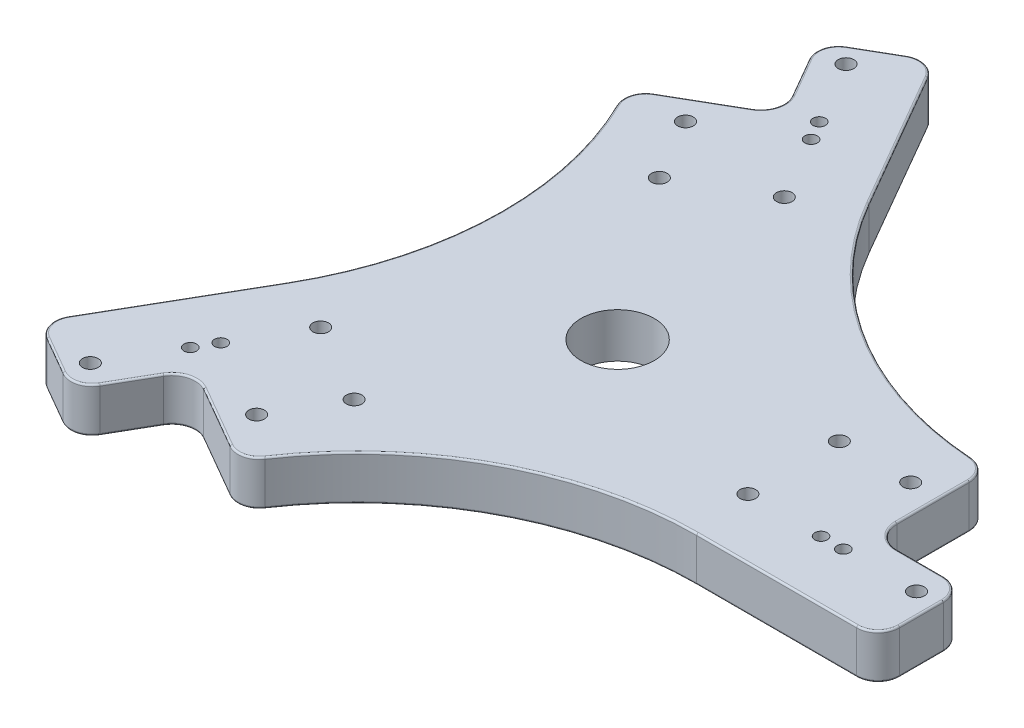
from build123d import *

# Parameters (mm, degrees)
SKETCH1_R                   = 41
BOSS_EXTRUDE1_DEPTH         = 50
FILLET2_R                   = 2
SKETCH3_R                   = 8.75
LOVIT_D17_5_THRU_DEPTH      = 623.015124039
SKETCH4_R                   = 12
LOBAC_D24X5_DEPTH           = 5
SKETCH5_R                   = 7
LOCHOT_D14_THRU_DEPTH       = 623.015124039
PATTERN_LOVIT_X3_COUNT      = 3
SKETCH6_R                   = 10
LOBAC_D20X5_DEPTH           = 5
PATTERN_LOBAC14_X3_COUNT    = 3
BOSS_EXTRUDE2_DEPTH         = 225
MATTREOVAU_D25_START        = -175
MATTREOVAU_D25_DEPTH        = 25
MATTREOVAU_GUSSET6_START    = -175
MATTREOVAU_GUSSET6_DEPTH    = 25
MATTREOVAU_GUSSET6_2_DEPTH  = 25
MATTREOVAU_GUSSET6_3_DEPTH  = 25
MATTREOVAU_GUSSET6_4_DEPTH  = 25
MATTREOVAU_GUSSET6_5_DEPTH  = 25
MATTREOTRON_X2_START        = -175
SKETCH10_R                  = 129.92
MATTREOTRON_X2_DEPTH        = 25
MATTREOTRON_X2_2_DEPTH      = 25
SK_TOOLCATKHUNG_W           = 940
SK_TOOLCATKHUNG_H           = 940
TOOL_CATCHANKHUNG_DEPTH     = 50
LOBAT_M16_X9_START          = -175
SK_LOVAU9_R                 = 7
LOBAT_M16_X9_DEPTH          = 25
LOGIUA_D150_START           = -175
SK_LOGIUA_R                 = 75
LOGIUA_D150_DEPTH           = 25
LOVIT_M20_X6_START          = -175
SKETCH12_R                  = 8.75
LOVIT_M20_X6_DEPTH          = 25
PADVIT_M12_X6_START         = -150
PADVIT_M12_X6_DEPTH         = 25
PADVIT_M12_X6_2_DEPTH       = 25
PADVIT_M12_X6_3_DEPTH       = 25
PADVIT_M12_X6_4_DEPTH       = 25
PADVIT_M12_X6_5_DEPTH       = 25
PADVIT_M12_X6_6_DEPTH       = 25
LOBU_M12_THRU_X6_START      = -175
SK_LOBU_M12_R               = 6.75
LOBU_M12_THRU_X6_DEPTH      = 25
LOBU_M12_CBORE_X6_START     = -187
SK_CBORE_M12_R              = 10
LOBU_M12_CBORE_X6_DEPTH     = 13
LOREN_M12_PAD_X6_START      = -175
SK_REN_M12_R                = 5.1
LOREN_M12_PAD_X6_DEPTH      = 20
BOSS_PADGOC_X3_START        = -175
SKETCH13_R                  = 32
BOSS_PADGOC_X3_DEPTH        = 25
BOSS_PADGOC_X3_2_DEPTH      = 25
BOSS_PADGOC_X3_3_DEPTH      = 25
LOBU_M12_THRU_GOC_X3_START  = -175
SKETCH14_R                  = 6.75
LOBU_M12_THRU_GOC_X3_DEPTH  = 12
LOBU_M12_CBORE_GOC_X3_START = -187
SKETCH15_R                  = 10
LOBU_M12_CBORE_GOC_X3_DEPTH = 13
LOREN_M12_GOC_X3_START      = -175
SKETCH16_R                  = 5.1
LOREN_M12_GOC_X3_DEPTH      = 20


with BuildPart() as part:
    # Sketch1 → Boss-Extrude1 (new body)
    with BuildSketch(Plane(origin=(0, 0, 0), x_dir=(1, 0, 0), z_dir=(0, 1, 0))):
        with BuildLine():
            Line((8.371578903, 273.5), (-81.292341855, 428.802466359))
            ThreePointArc((-81.292341855, 428.802466359), (-95.865294463, 439.98468619), (-114.076951546, 437.58707605))
            Line((-114.076951546, 437.58707605), (-156.512196331, 413.08707605))
            ThreePointArc((-156.512196331, 413.08707605), (-167.694416162, 398.514123442), (-165.296806022, 380.302466359))
            Line((-165.296806022, 380.302466359), (-139.296806022, 335.269145362))
            ThreePointArc((-139.296806022, 335.269145362), (-136.699395037, 315.53985019), (-148.813466521, 299.752484864))
            Line((-148.813466521, 299.752484864), (-218.954486267, 259.256548232))
            ThreePointArc((-218.954486267, 259.256548232), (-229.90514131, 245.491014911), (-228.527519154, 227.955082924))
            ThreePointArc((-228.527519154, 227.955082924), (-190.232761583, 47.667531746), (-241.043737387, -129.5))
            Line((-241.043737387, -129.5), (-330.707658145, -284.802466359))
            ThreePointArc((-330.707658145, -284.802466359), (-333.105268285, -303.014123442), (-321.923048454, -317.58707605))
            Line((-321.923048454, -317.58707605), (-279.487803669, -342.08707605))
            ThreePointArc((-279.487803669, -342.08707605), (-261.276146586, -344.48468619), (-246.703193978, -333.302466359))
            Line((-246.703193978, -333.302466359), (-220.703193978, -288.269145362))
            ThreePointArc((-220.703193978, -288.269145362), (-204.915828652, -276.155073879), (-185.186533479, -278.752484864))
            Line((-185.186533479, -278.752484864), (-115.045513733, -319.248421496))
            ThreePointArc((-115.045513733, -319.248421496), (-97.648884659, -321.849200291), (-83.151133157, -311.888178513))
            ThreePointArc((-83.151133157, -311.888178513), (53.835087364, -188.580170036), (232.672158483, -144))
            Line((232.672158483, -144), (412, -144))
            ThreePointArc((412, -144), (428.970562748, -136.970562748), (436, -120))
            Line((436, -120), (436, -71))
            ThreePointArc((436, -71), (428.970562748, -54.029437252), (412, -47))
            Line((412, -47), (360, -47))
            ThreePointArc((360, -47), (341.615223689, -39.384776311), (334, -21))
            Line((334, -21), (334, 59.991873264))
            ThreePointArc((334, 59.991873264), (327.554025969, 76.35818538), (311.678652311, 83.933095589))
            ThreePointArc((311.678652311, 83.933095589), (136.397674219, 140.91263829), (8.371578903, 273.5))
        make_face()
        with Locations(Location((0, 0, 0), (0, 0, 270))):
            Circle(SKETCH1_R, mode=Mode.SUBTRACT)
    extrude(amount=BOSS_EXTRUDE1_DEPTH)

    # Fillet2
    fillet2_edges = [part.edges().sort_by_distance(p)[0] for p in [
        (341.615223689, 50, 39.384776311),
        (334, 50, -19.495936632),
        (327.554025969, 50, -76.35818538),
        (-95.865294463, 50, -439.98468619),
        (-135.294573939, 50, -425.33707605),
        (-167.694416162, 50, -398.514123442),
        (-152.296806022, 50, -357.785805861),
        (327.554025969, 0, -76.35818538),
        (334, 0, -19.495936632),
        (341.615223689, 0, 39.384776311),
        (386, 0, 47),
        (428.970562748, 0, 54.029437252),
        (436, 0, 95.5),
        (428.970562748, 0, 136.970562748),
        (322.336079242, 0, 144),
        (53.835087364, 0, 188.580170036),
        (-136.699395037, 50, -315.53985019),
        (-97.648884659, 0, 321.849200291),
        (-150.116023606, 0, 299.00045318),
        (-204.915828652, 0, 276.155073879),
        (-233.703193978, 0, 310.785805861),
        (-261.276146586, 0, 344.48468619),
        (-300.705426061, 0, 329.83707605),
        (-333.105268285, 0, 303.014123442),
        (-285.875697766, 0, 207.15123318),
        (-190.232761583, 0, -47.667531746),
        (-229.90514131, 0, -245.491014911),
        (-183.883976394, 50, -279.504516548),
        (-183.883976394, 0, -279.504516548),
        (-136.699395037, 0, -315.53985019),
        (-152.296806022, 0, -357.785805861),
        (-167.694416162, 0, -398.514123442),
        (-135.294573939, 0, -425.33707605),
        (-95.865294463, 0, -439.98468619),
        (-36.460381476, 0, -351.15123318),
        (136.397674219, 0, -140.91263829),
        (-229.90514131, 50, -245.491014911),
        (-190.232761583, 50, -47.667531746),
        (-285.875697766, 50, 207.15123318),
        (-333.105268285, 50, 303.014123442),
        (136.397674219, 50, -140.91263829),
        (-300.705426061, 50, 329.83707605),
        (-261.276146586, 50, 344.48468619),
        (-233.703193978, 50, 310.785805861),
        (-204.915828652, 50, 276.155073879),
        (-150.116023606, 50, 299.00045318),
        (-97.648884659, 50, 321.849200291),
        (53.835087364, 50, 188.580170036),
        (322.336079242, 50, 144),
        (428.970562748, 50, 136.970562748),
        (436, 50, 95.5),
        (-36.460381476, 50, -351.15123318),
        (428.970562748, 50, 54.029437252),
        (386, 50, 47),
    ]]
    fillet(fillet2_edges, radius=FILLET2_R)

    # Sketch3 → LoVit-D17.5-Thru (cut, symmetric)
    with BuildSketch(Plane(origin=(0, 0, 0), x_dir=(1, 0, 0), z_dir=(0, 1, 0))):
        with Locations(Location((223, -77, 0), (0, 0, 270))):
            Circle(SKETCH3_R)
        with Locations(Location((412, -77, 0), (0, 0, 270))):
            Circle(SKETCH3_R)
        with Locations(Location((303, 25.5, 0), (0, 0, 270))):
            Circle(SKETCH3_R)
        with Locations(Location((223, 25.5, 0), (0, 0, 270))):
            Circle(SKETCH3_R)
    lovit_d17_5_thru = extrude(amount=LOVIT_D17_5_THRU_DEPTH, both=True, mode=Mode.SUBTRACT)

    # Sketch4 → LoBac-D24x5 (cut)
    with BuildSketch(Plane(origin=(0, 0, 0), x_dir=(1, 0, 0), z_dir=(0, 1, 0))):
        with Locations(Location((223, -77, 0), (0, 0, 270))):
            Circle(SKETCH4_R)
        with Locations(Location((412, -77, 0), (0, 0, 270))):
            Circle(SKETCH4_R)
        with Locations(Location((303, 25.5, 0), (0, 0, 270))):
            Circle(SKETCH4_R)
        with Locations(Location((223, 25.5, 0), (0, 0, 270))):
            Circle(SKETCH4_R)
    lobac_d24x5 = extrude(amount=LOBAC_D24X5_DEPTH, mode=Mode.SUBTRACT)

    # Sketch5 → LoChot-D14-Thru (cut, symmetric)
    with BuildSketch(Plane(origin=(0, 0, 0), x_dir=(1, 0, 0), z_dir=(0, 1, 0))):
        with Locations(Location((305, -77, 0), (0, 0, 270))):
            Circle(SKETCH5_R)
        with Locations(Location((330, -77, 0), (0, 0, 270))):
            Circle(SKETCH5_R)
    lochot_d14_thru = extrude(amount=LOCHOT_D14_THRU_DEPTH, both=True, mode=Mode.SUBTRACT)

    # Pattern-LoVit-x3: LoVit-D17.5-Thru, LoBac-D24x5, LoChot-D14-Thru ×3 about axis
    pattern_lovit_x3_axis = Axis((0, 0, 0), (0, 1, 0))
    add([lovit_d17_5_thru.rotate(pattern_lovit_x3_axis, i * 360 / PATTERN_LOVIT_X3_COUNT) for i in range(1, PATTERN_LOVIT_X3_COUNT)], mode=Mode.SUBTRACT)
    add([lobac_d24x5.rotate(pattern_lovit_x3_axis, i * 360 / PATTERN_LOVIT_X3_COUNT) for i in range(1, PATTERN_LOVIT_X3_COUNT)], mode=Mode.SUBTRACT)
    add([lochot_d14_thru.rotate(pattern_lovit_x3_axis, i * 360 / PATTERN_LOVIT_X3_COUNT) for i in range(1, PATTERN_LOVIT_X3_COUNT)], mode=Mode.SUBTRACT)

    # Sketch6 → LoBac-D20x5 (cut)
    with BuildSketch(Plane(origin=(0, 0, 0), x_dir=(1, 0, 0), z_dir=(0, 1, 0))):
        with Locations(Location((305, -77, 0), (0, 0, 270))):
            Circle(SKETCH6_R)
        with Locations(Location((330, -77, 0), (0, 0, 270))):
            Circle(SKETCH6_R)
    lobac_d20x5 = extrude(amount=LOBAC_D20X5_DEPTH, mode=Mode.SUBTRACT)

    # Pattern-LoBac14-x3: LoBac-D20x5 ×3 about axis
    pattern_lobac14_x3_axis = Axis((0, 0, 0), (0, 1, 0))
    for i in range(1, PATTERN_LOBAC14_X3_COUNT):
        add(lobac_d20x5.rotate(pattern_lobac14_x3_axis, i * 360 / PATTERN_LOBAC14_X3_COUNT), mode=Mode.SUBTRACT)


with BuildPart() as body_2:
    # Sketch7 → Boss-Extrude2 (new body)
    with BuildSketch(Plane(origin=(0, 50, 0), x_dir=(1, 0, 0), z_dir=(0, 1, 0))):
        with BuildLine():
            Line((-184.186533479, -277.020434056), (-114.045513733, -317.516370688))
            ThreePointArc((-114.045513733, -317.516370688), (-98.098603748, -319.900417917), (-84.808998205, -310.769481287))
            ThreePointArc((-84.808998205, -310.769481287), (52.896310087, -186.814186676), (232.672158483, -142))
            Line((232.672158483, -142), (412, -142))
            ThreePointArc((412, -142), (427.556349186, -135.556349186), (434, -120))
            Line((434, -120), (434, -71))
            ThreePointArc((434, -71), (427.556349186, -55.443650814), (412, -49))
            Line((412, -49), (360, -49))
            ThreePointArc((360, -49), (340.201010127, -40.798989873), (332, -21))
            Line((332, -21), (332, 59.991873264))
            ThreePointArc((332, 59.991873264), (326.091190472, 74.994326037), (311.538764618, 81.937993729))
            ThreePointArc((311.538764618, 81.937993729), (135.337676405, 139.21664164), (6.639528096, 272.5))
            Line((6.639528096, 272.5), (-83.024392663, 427.802466359))
            ThreePointArc((-83.024392663, 427.802466359), (-96.382932554, 438.052834538), (-113.076951546, 435.855025242))
            Line((-113.076951546, 435.855025242), (-155.512196331, 411.355025242))
            ThreePointArc((-155.512196331, 411.355025242), (-165.76256451, 397.996485351), (-163.564755215, 381.302466359))
            Line((-163.564755215, 381.302466359), (-137.564755215, 336.269145362))
            ThreePointArc((-137.564755215, 336.269145362), (-134.767543384, 315.0222121), (-147.813466521, 298.020434056))
            Line((-147.813466521, 298.020434056), (-217.954486267, 257.524497424))
            ThreePointArc((-217.954486267, 257.524497424), (-227.992586724, 244.90609188), (-226.729766413, 228.831487559))
            ThreePointArc((-226.729766413, 228.831487559), (-188.233986493, 47.597545036), (-239.311686579, -130.5))
            Line((-239.311686579, -130.5), (-328.975607337, -285.802466359))
            ThreePointArc((-328.975607337, -285.802466359), (-331.173416632, -302.496485351), (-320.923048454, -315.855025242))
            Line((-320.923048454, -315.855025242), (-278.487803669, -340.355025242))
            ThreePointArc((-278.487803669, -340.355025242), (-261.793784676, -342.552834538), (-248.435244785, -332.302466359))
            Line((-248.435244785, -332.302466359), (-222.435244785, -287.269145362))
            ThreePointArc((-222.435244785, -287.269145362), (-205.433466742, -274.223222226), (-184.186533479, -277.020434056))
        make_face()
        with BuildLine():
            Line((-180.186533479, -270.092230826), (-110.045513733, -310.588167458))
            ThreePointArc((-110.045513733, -310.588167458), (-99.897480106, -312.105288422), (-91.440458397, -306.294692385))
            ThreePointArc((-91.440458397, -306.294692385), (49.141200982, -179.750253239), (232.672158483, -134))
            Line((232.672158483, -134), (412, -134))
            ThreePointArc((412, -134), (421.899494937, -129.899494937), (426, -120))
            Line((426, -120), (426, -71))
            ThreePointArc((426, -71), (421.899494937, -61.100505063), (412, -57))
            Line((412, -57), (360, -57))
            ThreePointArc((360, -57), (334.544155877, -46.455844123), (324, -21))
            Line((324, -21), (324, 59.991873264))
            ThreePointArc((324, 59.991873264), (320.239848482, 69.538888665), (310.979213848, 73.957586287))
            ThreePointArc((310.979213848, 73.957586287), (131.09768515, 132.432655043), (-0.288675135, 268.5))
            Line((-0.288675135, 268.5), (-89.952595893, 423.802466359))
            ThreePointArc((-89.952595893, 423.802466359), (-98.453484914, 430.325427927), (-109.076951546, 428.926822012))
            Line((-109.076951546, 428.926822012), (-151.512196331, 404.426822012))
            ThreePointArc((-151.512196331, 404.426822012), (-158.035157899, 395.925932991), (-156.636551984, 385.302466359))
            Line((-156.636551984, 385.302466359), (-130.636551984, 340.269145362))
            ThreePointArc((-130.636551984, 340.269145362), (-127.040136774, 312.951659739), (-143.813466521, 291.092230826))
            Line((-143.813466521, 291.092230826), (-213.954486267, 250.596294194))
            ThreePointArc((-213.954486267, 250.596294194), (-220.342368376, 242.566399757), (-219.538755451, 232.337106098))
            ThreePointArc((-219.538755451, 232.337106098), (-180.238886133, 47.317598196), (-232.383483349, -134.5))
            Line((-232.383483349, -134.5), (-322.047404107, -289.802466359))
            ThreePointArc((-322.047404107, -289.802466359), (-323.446010022, -300.425932991), (-316.923048454, -308.926822012))
            Line((-316.923048454, -308.926822012), (-274.487803669, -333.426822012))
            ThreePointArc((-274.487803669, -333.426822012), (-263.864337037, -334.825427927), (-255.363448016, -328.302466359))
            Line((-255.363448016, -328.302466359), (-229.363448016, -283.269145362))
            ThreePointArc((-229.363448016, -283.269145362), (-207.504019103, -266.495815616), (-180.186533479, -270.092230826))
        make_face(mode=Mode.SUBTRACT)
    extrude(amount=-BOSS_EXTRUDE2_DEPTH)


with BuildPart() as body_3:
    # Sk-MatTreoVau → MatTreoVau-D25 (new body)
    with BuildSketch(Plane(origin=(0, 0, 0), x_dir=(1, 0, 0), z_dir=(0, 1, 0)).offset(MATTREOVAU_D25_START)):
        with BuildLine():
            Line((-114.045513733, -317.516370688), (-184.186533479, -277.020434056))
            ThreePointArc((-184.186533479, -277.020434056), (-205.433466742, -274.223222226), (-222.435244785, -287.269145362))
            Line((-222.435244785, -287.269145362), (-248.435244785, -332.302466359))
            ThreePointArc((-248.435244785, -332.302466359), (-261.793784676, -342.552834538), (-278.487803669, -340.355025242))
            Line((-278.487803669, -340.355025242), (-320.923048454, -315.855025242))
            ThreePointArc((-320.923048454, -315.855025242), (-331.173416632, -302.496485351), (-328.975607337, -285.802466359))
            Line((-328.975607337, -285.802466359), (-239.311686579, -130.5))
            ThreePointArc((-239.311686579, -130.5), (-218.0908365, -87.810397331), (-202.337273797, -42.815376315))
            ThreePointArc((-202.337273797, -42.815376315), (-206.139748433, -21.394031931), (-225.28696343, -11.0636415))
            ThreePointArc((-225.28696343, -11.0636415), (-258.528834053, 27.619593831), (-217.865133416, 58.407222981))
            ThreePointArc((-217.865133416, 58.407222981), (-196.967697859, 64.459494929), (-188.725649398, 84.594078256))
            ThreePointArc((-188.725649398, 84.594078256), (-200.638746521, 158.580604294), (-226.729766413, 228.831487559))
            ThreePointArc((-226.729766413, 228.831487559), (-227.992586724, 244.90609188), (-217.954486267, 257.524497424))
            Line((-217.954486267, 257.524497424), (-147.813466521, 298.020434056))
            ThreePointArc((-147.813466521, 298.020434056), (-134.767543384, 315.0222121), (-137.564755215, 336.269145362))
            Line((-137.564755215, 336.269145362), (-163.564755215, 381.302466359))
            ThreePointArc((-163.564755215, 381.302466359), (-165.76256451, 397.996485351), (-155.512196331, 411.355025242))
            Line((-155.512196331, 411.355025242), (-113.076951546, 435.855025242))
            ThreePointArc((-113.076951546, 435.855025242), (-96.382932554, 438.052834538), (-83.024392663, 427.802466359))
            Line((-83.024392663, 427.802466359), (6.639528096, 272.5))
            ThreePointArc((6.639528096, 272.5), (32.999383444, 232.777403407), (64.089433337, 196.636907398))
            ThreePointArc((64.089433337, 196.636907398), (84.542099075, 189.219274839), (103.062087117, 200.636054222))
            ThreePointArc((103.062087117, 200.636054222), (153.183686926, 210.082740985), (159.514705574, 159.473128647))
            ThreePointArc((159.514705574, 159.473128647), (154.307409053, 138.349282607), (167.623445478, 121.144167596))
            ThreePointArc((167.623445478, 121.144167596), (237.654205127, 94.467949324), (311.538764618, 81.937993729))
            ThreePointArc((311.538764618, 81.937993729), (326.091190472, 74.994326037), (332, 59.991873264))
            Line((332, 59.991873264), (332, -21))
            ThreePointArc((332, -21), (340.201010127, -40.798989873), (360, -49))
            Line((360, -49), (412, -49))
            ThreePointArc((412, -49), (427.556349186, -55.443650814), (434, -71))
            Line((434, -71), (434, -120))
            ThreePointArc((434, -120), (427.556349186, -135.556349186), (412, -142))
            Line((412, -142), (232.672158483, -142))
            ThreePointArc((232.672158483, -142), (185.091453055, -144.967006076), (138.24784046, -153.821531083))
            ThreePointArc((138.24784046, -153.821531083), (121.597649359, -167.825242907), (122.224876312, -189.572412722))
            ThreePointArc((122.224876312, -189.572412722), (105.345147127, -237.702334816), (58.350427842, -217.880351628))
            ThreePointArc((58.350427842, -217.880351628), (42.660288806, -202.808777536), (21.10220392, -205.738245852))
            ThreePointArc((21.10220392, -205.738245852), (-37.015458606, -253.048553618), (-84.808998205, -310.769481287))
            ThreePointArc((-84.808998205, -310.769481287), (-98.098603748, -319.900417917), (-114.045513733, -317.516370688))
        make_face()
    extrude(amount=-MATTREOVAU_D25_DEPTH)


with BuildPart() as body_4:
    # Sketch8 → MatTreoVau-Gusset6 (new body)
    with BuildSketch(Plane(origin=(0, 0, 0), x_dir=(1, 0, 0), z_dir=(0, 1, 0)).offset(MATTREOVAU_GUSSET6_START)):
        Polygon((-137.497159422, -74.963532139), (-156.055536108, 13.10227652), (-294.846276167, -31.474965139), (-282.474025043, -90.185504245), align=None)
    extrude(amount=-MATTREOVAU_GUSSET6_DEPTH)


with BuildPart() as body_5:
    # Sketch8 → MatTreoVau-Gusset6 2 (new body)
    with BuildSketch(Plane(origin=(0, 0, 0), x_dir=(1, 0, 0), z_dir=(0, 1, 0)).offset(MATTREOVAU_GUSSET6_START)):
        Polygon((-155.299997302, 20.172031082), (-118.550255868, 102.327107033), (-257.036168472, 147.842511129), (-281.535996095, 93.072460496), align=None)
    extrude(amount=-MATTREOVAU_GUSSET6_2_DEPTH)


with BuildPart() as body_6:
    # Sketch8 → MatTreoVau-Gusset6 3 (new body)
    with BuildSketch(Plane(origin=(0, 0, 0), x_dir=(1, 0, 0), z_dir=(0, 1, 0)).offset(MATTREOVAU_GUSSET6_START)):
        Polygon((3.828256521, 156.557799078), (89.374672368, 128.596920411), (120.16501869, 271.081847941), (63.134074792, 289.722433719), align=None)
    extrude(amount=-MATTREOVAU_GUSSET6_3_DEPTH)


with BuildPart() as body_7:
    # Sketch8 → MatTreoVau-Gusset6 4 (new body)
    with BuildSketch(Plane(origin=(0, 0, 0), x_dir=(1, 0, 0), z_dir=(0, 1, 0)).offset(MATTREOVAU_GUSSET6_START)):
        Polygon((95.119490014, 124.40772733), (147.89300212, 51.50397969), (256.553454634, 148.678596024), (221.371113229, 197.28109445), align=None)
    extrude(amount=-MATTREOVAU_GUSSET6_4_DEPTH)


with BuildPart() as body_8:
    # Sketch8 → MatTreoVau-Gusset6 5 (new body)
    with BuildSketch(Plane(origin=(0, 0, 0), x_dir=(1, 0, 0), z_dir=(0, 1, 0)).offset(MATTREOVAU_GUSSET6_START)):
        with BuildLine():
            Line((-29.342746252, -153.831086723), (133.668902901, -81.594266938))
            ThreePointArc((133.668902901, -81.594266938), (143.083176972, -322.885541111), (-29.342746252, -153.831086723))
        make_face()
    extrude(amount=-MATTREOVAU_GUSSET6_5_DEPTH)


with BuildPart() as body_9:
    # Sketch10 → MatTreoTron-x2 (new body)
    with BuildSketch(Plane(origin=(0, 0, 0), x_dir=(1, 0, 0), z_dir=(0, 1, 0)).offset(MATTREOTRON_X2_START)):
        with Locations(Location((131.555784912, 180.338696502, 0), (0, 0, 270))):
            Circle(SKETCH10_R)
    extrude(amount=-MATTREOTRON_X2_DEPTH)


with BuildPart() as body_10:
    # Sketch10 → MatTreoTron-x2 2 (new body)
    with BuildSketch(Plane(origin=(0, 0, 0), x_dir=(1, 0, 0), z_dir=(0, 1, 0)).offset(MATTREOTRON_X2_START)):
        with Locations(Location((-221.955784912, 23.761303498, 0), (0, 0, 270))):
            Circle(SKETCH10_R)
    extrude(amount=-MATTREOTRON_X2_2_DEPTH)


with BuildPart() as body_3_1:
    add(body_3.part)

    # GopKhoi-MatTreo: union body 8, body 10, body 5, body 6, body 4, body 9, body 7
    add(body_8.part)
    add(body_10.part)
    add(body_5.part)
    add(body_6.part)
    add(body_4.part)
    add(body_9.part)
    add(body_7.part)

    # Sk-LoVau9 → LoBat-M16-x9 (cut)
    with BuildSketch(Plane(origin=(0, 0, 0), x_dir=(1, 0, 0), z_dir=(0, 1, 0)).offset(LOBAT_M16_X9_START)):
        with Locations(Location((412, -71, 0), (0, 0, 270))):
            Circle(SK_LOVAU9_R)
        with Locations(Location((412, -120, 0), (0, 0, 270))):
            Circle(SK_LOVAU9_R)
        with Locations(Location((-102.077, 416.802, 0), (0, 0, 270))):
            Circle(SK_LOVAU9_R)
        with Locations(Location((-144.512, 392.302, 0), (0, 0, 270))):
            Circle(SK_LOVAU9_R)
        with Locations(Location((-267.488, -321.302, 0), (0, 0, 270))):
            Circle(SK_LOVAU9_R)
        with Locations(Location((-309.923, -296.802, 0), (0, 0, 270))):
            Circle(SK_LOVAU9_R)
        with Locations(Location((-206.954, 238.472, 0), (0, 0, 270))):
            Circle(SK_LOVAU9_R)
        with Locations(Location((310, 59.992, 0), (0, 0, 270))):
            Circle(SK_LOVAU9_R)
        with Locations(Location((-103.046, -298.464, 0), (0, 0, 270))):
            Circle(SK_LOVAU9_R)
    extrude(amount=-LOBAT_M16_X9_DEPTH, mode=Mode.SUBTRACT)

    # Sk-LoGiua → LoGiua-D150 (cut)
    with BuildSketch(Plane(origin=(0, 0, 0), x_dir=(1, 0, 0), z_dir=(0, 1, 0)).offset(LOGIUA_D150_START)):
        with Locations(Location((0, 0, 0), (0, 0, 270))):
            Circle(SK_LOGIUA_R)
    extrude(amount=-LOGIUA_D150_DEPTH, mode=Mode.SUBTRACT)

    # Sketch12 → LoVit-M20-x6 (cut)
    with BuildSketch(Plane(origin=(0, 0, 0), x_dir=(1, 0, 0), z_dir=(0, 1, 0)).offset(LOVIT_M20_X6_START)):
        with Locations(Location((173.636464422, -193.52100202, 0), (0, 0, 270))):
            Circle(SKETCH12_R)
        with Locations(Location((26.726059565, -258.62273245, 0), (0, 0, 270))):
            Circle(SKETCH12_R)
        with Locations(Location((80.775871704, 247.134090223, 0), (0, 0, 270))):
            Circle(SKETCH12_R)
        with Locations(Location((210.610826516, 152.456812751, 0), (0, 0, 270))):
            Circle(SKETCH12_R)
        with Locations(Location((-254.412336126, -53.613088203, 0), (0, 0, 270))):
            Circle(SKETCH12_R)
        with Locations(Location((-237.336886081, 106.165919699, 0), (0, 0, 270))):
            Circle(SKETCH12_R)
    extrude(amount=-LOVIT_M20_X6_DEPTH, mode=Mode.SUBTRACT)

    # Sk-LoBu-M12 → LoBu-M12-Thru-x6 (cut)
    with BuildSketch(Plane(origin=(0, 0, 0), x_dir=(1, 0, 0), z_dir=(0, 1, 0)).offset(LOBU_M12_THRU_X6_START)):
        with Locations(Location((7.886992904, -190.512930413, 0), (0, 0, 270))):
            Circle(SK_LOBU_M12_R)
        with Locations(Location((135.844382435, -133.804652657, 0), (0, 0, 270))):
            Circle(SK_LOBU_M12_R)
        with Locations(Location((161.04705128, 102.088745556, 0), (0, 0, 270))):
            Circle(SK_LOBU_M12_R)
        with Locations(Location((47.957582181, 184.54900435, 0), (0, 0, 270))):
            Circle(SK_LOBU_M12_R)
        with Locations(Location((-168.934294158, 88.425684784, 0), (0, 0, 270))):
            Circle(SK_LOBU_M12_R)
        with Locations(Location((-183.801686509, -50.742856727, 0), (0, 0, 270))):
            Circle(SK_LOBU_M12_R)
    extrude(amount=-LOBU_M12_THRU_X6_DEPTH, mode=Mode.SUBTRACT)

    # Sk-CBore-M12 → LoBu-M12-CBore-x6 (cut)
    with BuildSketch(Plane(origin=(0, 0, 0), x_dir=(1, 0, 0), z_dir=(0, 1, 0)).offset(LOBU_M12_CBORE_X6_START)):
        with Locations(Location((7.886992904, -190.512930413, 0), (0, 0, 270))):
            Circle(SK_CBORE_M12_R)
        with Locations(Location((135.844382435, -133.804652657, 0), (0, 0, 270))):
            Circle(SK_CBORE_M12_R)
        with Locations(Location((161.04705128, 102.088745556, 0), (0, 0, 270))):
            Circle(SK_CBORE_M12_R)
        with Locations(Location((47.957582181, 184.54900435, 0), (0, 0, 270))):
            Circle(SK_CBORE_M12_R)
        with Locations(Location((-168.934294158, 88.425684784, 0), (0, 0, 270))):
            Circle(SK_CBORE_M12_R)
        with Locations(Location((-183.801686509, -50.742856727, 0), (0, 0, 270))):
            Circle(SK_CBORE_M12_R)
    extrude(amount=-LOBU_M12_CBORE_X6_DEPTH, mode=Mode.SUBTRACT)

    # Sketch14 → LoBu-M12-Thru-Goc-x3 (cut)
    with BuildSketch(Plane(origin=(0, 0, 0), x_dir=(1, 0, 0), z_dir=(0, 1, 0)).offset(LOBU_M12_THRU_GOC_X3_START)):
        with Locations(Location((299.502544984, -17.269208088, 0), (0, 0, 270))):
            Circle(SKETCH14_R)
        with Locations(Location((-164.706845399, -250.74220841, 0), (0, 0, 270))):
            Circle(SKETCH14_R)
        with Locations(Location((-134.795699585, 268.011416498, 0), (0, 0, 270))):
            Circle(SKETCH14_R)
    extrude(amount=-LOBU_M12_THRU_GOC_X3_DEPTH, mode=Mode.SUBTRACT)

    # Sketch15 → LoBu-M12-CBore-Goc-x3 (cut)
    with BuildSketch(Plane(origin=(0, 0, 0), x_dir=(1, 0, 0), z_dir=(0, 1, 0)).offset(LOBU_M12_CBORE_GOC_X3_START)):
        with Locations(Location((299.502544984, -17.269208088, 0), (0, 0, 270))):
            Circle(SKETCH15_R)
        with Locations(Location((-164.706845399, -250.74220841, 0), (0, 0, 270))):
            Circle(SKETCH15_R)
        with Locations(Location((-134.795699585, 268.011416498, 0), (0, 0, 270))):
            Circle(SKETCH15_R)
    extrude(amount=-LOBU_M12_CBORE_GOC_X3_DEPTH, mode=Mode.SUBTRACT)


with BuildPart() as body_4_2:
    # Sk-ToolCatKhung → Tool-CatChanKhung (new body)
    with BuildSketch(Plane(origin=(0, 0, 0), x_dir=(1, 0, 0), z_dir=(0, 1, 0))):
        Rectangle(SK_TOOLCATKHUNG_W, SK_TOOLCATKHUNG_H)
    extrude(amount=TOOL_CATCHANKHUNG_DEPTH)


with BuildPart() as body_2_1:
    add(body_2.part)

    # CatChanKhung: cut body 4 2
    add(body_4_2.part, mode=Mode.SUBTRACT)


with BuildPart() as body_4_3:
    # Sk-PadVit-M12 → PadVit-M12-x6 (new body)
    with BuildSketch(Plane(origin=(0, 0, 0), x_dir=(1, 0, 0), z_dir=(0, 1, 0)).offset(PADVIT_M12_X6_START)):
        with BuildLine():
            Line((33.404320909, -192.077803179), (19.024323449, -168.052490006))
            ThreePointArc((19.024323449, -168.052490006), (0.635928159, -179.723024942), (-17.116477868, -192.339940068))
            Line((-17.116477868, -192.339940068), (-0.303926473, -214.730521025))
            ThreePointArc((-0.303926473, -214.730521025), (16.253606071, -202.962821341), (33.404320909, -192.077803179))
        make_face()
    extrude(amount=-PADVIT_M12_X6_DEPTH)


with BuildPart() as body_5_2:
    # Sk-PadVit-M12 → PadVit-M12-x6 2 (new body)
    with BuildSketch(Plane(origin=(0, 0, 0), x_dir=(1, 0, 0), z_dir=(0, 1, 0)).offset(PADVIT_M12_X6_START)):
        with BuildLine():
            Line((119.864532126, -153.760284428), (111.723931352, -126.96978949))
            ThreePointArc((111.723931352, -126.96978949), (132.720975416, -121.185447904), (153.99197281, -116.507933936))
            Line((153.99197281, -116.507933936), (159.287609255, -144.002592229))
            ThreePointArc((159.287609255, -144.002592229), (139.44831361, -148.365273526), (119.864532126, -153.760284428))
        make_face()
    extrude(amount=-PADVIT_M12_X6_2_DEPTH)


with BuildPart() as body_6_2:
    # Sk-PadVit-M12 → PadVit-M12-x6 3 (new body)
    with BuildSketch(Plane(origin=(0, 0, 0), x_dir=(1, 0, 0), z_dir=(0, 1, 0)).offset(PADVIT_M12_X6_START)):
        with BuildLine():
            Line((149.643616505, 124.969841041), (136.027073366, 100.503747096))
            ThreePointArc((136.027073366, 100.503747096), (155.328246483, 90.414188961), (175.131014685, 81.348603567))
            Line((175.131014685, 81.348603567), (186.115561774, 107.103986019))
            ThreePointArc((186.115561774, 107.103986019), (167.6456722, 115.559387781), (149.643616505, 124.969841041))
        make_face()
    extrude(amount=-PADVIT_M12_X6_3_DEPTH)


with BuildPart() as body_7_2:
    # Sk-PadVit-M12 → PadVit-M12-x6 4 (new body)
    with BuildSketch(Plane(origin=(0, 0, 0), x_dir=(1, 0, 0), z_dir=(0, 1, 0)).offset(PADVIT_M12_X6_START)):
        with BuildLine():
            Line((73.229589768, 180.687853253), (54.098632328, 160.242646786))
            ThreePointArc((54.098632328, 160.242646786), (38.590729993, 175.534456103), (23.904392162, 191.616929425))
            Line((23.904392162, 191.616929425), (45.067654228, 209.950405329))
            ThreePointArc((45.067654228, 209.950405329), (58.765488551, 194.950406173), (73.229589768, 180.687853253))
        make_face()
    extrude(amount=-PADVIT_M12_X6_4_DEPTH)


with BuildPart() as body_8_2:
    # Sk-PadVit-M12 → PadVit-M12-x6 5 (new body)
    with BuildSketch(Plane(origin=(0, 0, 0), x_dir=(1, 0, 0), z_dir=(0, 1, 0)).offset(PADVIT_M12_X6_START)):
        with BuildLine():
            Line((-183.048102175, 67.109416853), (-155.051573466, 67.550302605))
            ThreePointArc((-155.051573466, 67.550302605), (-155.964432679, 89.310384293), (-158.014875534, 110.992869186))
            Line((-158.014875534, 110.992869186), (-185.811951219, 107.627964529))
            ThreePointArc((-185.811951219, 107.627964529), (-183.899518941, 87.404877658), (-183.048102175, 67.109416853))
        make_face()
    extrude(amount=-PADVIT_M12_X6_5_DEPTH)


with BuildPart() as body_9_2:
    # Sk-PadVit-M12 → PadVit-M12-x6 6 (new body)
    with BuildSketch(Plane(origin=(0, 0, 0), x_dir=(1, 0, 0), z_dir=(0, 1, 0)).offset(PADVIT_M12_X6_START)):
        with BuildLine():
            Line((-193.093929834, -26.926117461), (-165.82235776, -33.271301195))
            ThreePointArc((-165.82235776, -33.271301195), (-171.311418332, -54.347465008), (-177.895997523, -75.107469437))
            Line((-177.895997523, -75.107469437), (-204.354920767, -65.946389764))
            ThreePointArc((-204.354920767, -65.946389764), (-198.213534405, -46.583693325), (-193.093929834, -26.926117461))
        make_face()
    extrude(amount=-PADVIT_M12_X6_6_DEPTH)


with BuildPart() as body_2_2:
    add(body_2_1.part)

    # GopKhung-Pad: union body 8 2, body 9 2, body 5 2, body 6 2, body 4 3, body 7 2
    add(body_8_2.part)
    add(body_9_2.part)
    add(body_5_2.part)
    add(body_6_2.part)
    add(body_4_3.part)
    add(body_7_2.part)

    # Sk-Ren-M12 → LoRen-M12-Pad-x6 (cut)
    with BuildSketch(Plane(origin=(0, 0, 0), x_dir=(1, 0, 0), z_dir=(0, 1, 0)).offset(LOREN_M12_PAD_X6_START)):
        with Locations(Location((7.886992904, -190.512930413, 0), (0, 0, 270))):
            Circle(SK_REN_M12_R)
        with Locations(Location((135.844382435, -133.804652657, 0), (0, 0, 270))):
            Circle(SK_REN_M12_R)
        with Locations(Location((161.04705128, 102.088745556, 0), (0, 0, 270))):
            Circle(SK_REN_M12_R)
        with Locations(Location((47.957582181, 184.54900435, 0), (0, 0, 270))):
            Circle(SK_REN_M12_R)
        with Locations(Location((-168.934294158, 88.425684784, 0), (0, 0, 270))):
            Circle(SK_REN_M12_R)
        with Locations(Location((-183.801686509, -50.742856727, 0), (0, 0, 270))):
            Circle(SK_REN_M12_R)
    extrude(amount=LOREN_M12_PAD_X6_DEPTH, mode=Mode.SUBTRACT)


with BuildPart() as body_4_4:
    # Sketch13 → Boss-PadGoc-x3 (new body)
    with BuildSketch(Plane(origin=(0, 0, 0), x_dir=(1, 0, 0), z_dir=(0, 1, 0)).offset(BOSS_PADGOC_X3_START)):
        with Locations(Location((299.502544984, -17.269208088, 0), (0, 0, 270))):
            Circle(SKETCH13_R)
    extrude(amount=BOSS_PADGOC_X3_DEPTH)


with BuildPart() as body_5_3:
    # Sketch13 → Boss-PadGoc-x3 2 (new body)
    with BuildSketch(Plane(origin=(0, 0, 0), x_dir=(1, 0, 0), z_dir=(0, 1, 0)).offset(BOSS_PADGOC_X3_START)):
        with Locations(Location((-164.706845399, -250.74220841, 0), (0, 0, 270))):
            Circle(SKETCH13_R)
    extrude(amount=BOSS_PADGOC_X3_2_DEPTH)


with BuildPart() as body_6_3:
    # Sketch13 → Boss-PadGoc-x3 3 (new body)
    with BuildSketch(Plane(origin=(0, 0, 0), x_dir=(1, 0, 0), z_dir=(0, 1, 0)).offset(BOSS_PADGOC_X3_START)):
        with Locations(Location((-134.795699585, 268.011416498, 0), (0, 0, 270))):
            Circle(SKETCH13_R)
    extrude(amount=BOSS_PADGOC_X3_3_DEPTH)


with BuildPart() as body_2_3:
    add(body_2_2.part)

    # Khoi2-KhungHan: union body 6 3, body 4 4, body 5 3
    add(body_6_3.part)
    add(body_4_4.part)
    add(body_5_3.part)

    # Sketch16 → LoRen-M12-Goc-x3 (cut)
    with BuildSketch(Plane(origin=(0, 0, 0), x_dir=(1, 0, 0), z_dir=(0, 1, 0)).offset(LOREN_M12_GOC_X3_START)):
        with Locations(Location((299.502544984, -17.269208088, 0), (0, 0, 270))):
            Circle(SKETCH16_R)
        with Locations(Location((-164.706845399, -250.74220841, 0), (0, 0, 270))):
            Circle(SKETCH16_R)
        with Locations(Location((-134.795699585, 268.011416498, 0), (0, 0, 270))):
            Circle(SKETCH16_R)
    extrude(amount=LOREN_M12_GOC_X3_DEPTH, mode=Mode.SUBTRACT)


solid = part.part
